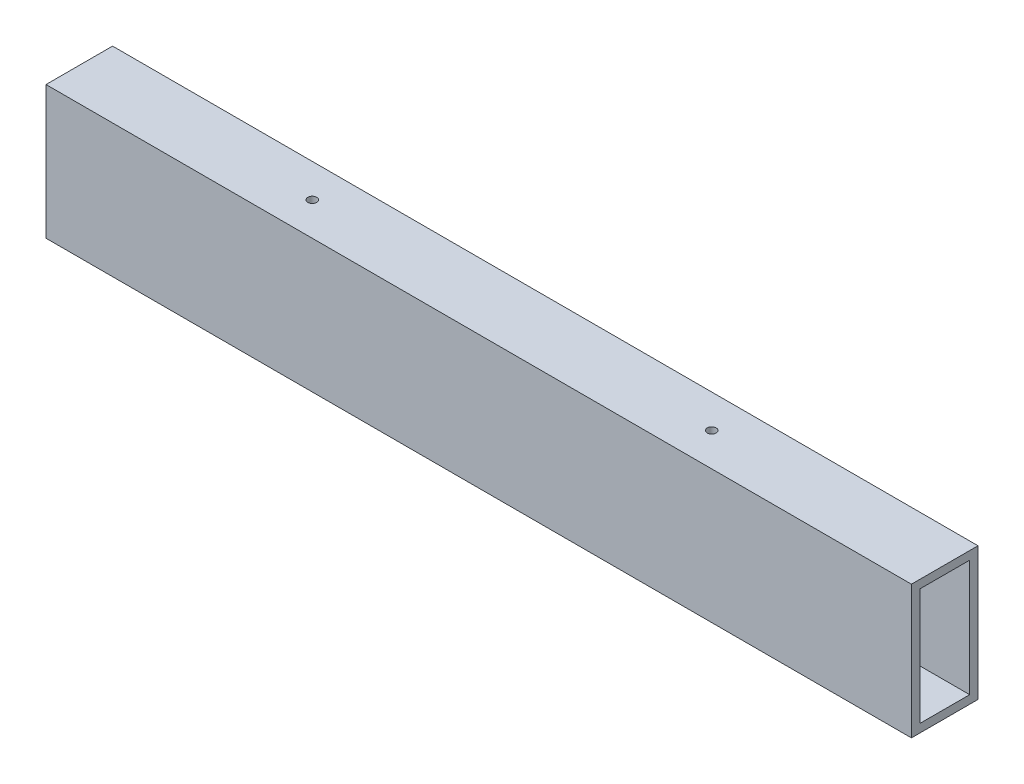
from build123d import *

# Parameters (mm, degrees)
SKETCH1_W            = 25.4
SKETCH1_H            = 50.8
SKETCH1_W_2          = 19.05
SKETCH1_H_2          = 44.45
BOSS_EXTRUDE1_DEPTH  = 330.2
M3_CLEARANCE_HOLE6_D = 3.4


with BuildPart() as part:
    # Sketch1 → Boss-Extrude1 (new body)
    with BuildSketch(Plane(origin=(0, 0, 0), x_dir=(0, 0, -1), z_dir=(1, 0, 0))):
        Rectangle(SKETCH1_W, SKETCH1_H)
        Rectangle(SKETCH1_W_2, SKETCH1_H_2, mode=Mode.SUBTRACT)
    extrude(amount=BOSS_EXTRUDE1_DEPTH)

    # M3 Clearance Hole6 (through all)
    with Locations(Plane(origin=(88.9, -25.4, 0), x_dir=(0, 0, -1), z_dir=(0, -1, 0))):
        with Locations((0, 0), (0, 152.4)):
            Hole(M3_CLEARANCE_HOLE6_D / 2)


solid = part.part
